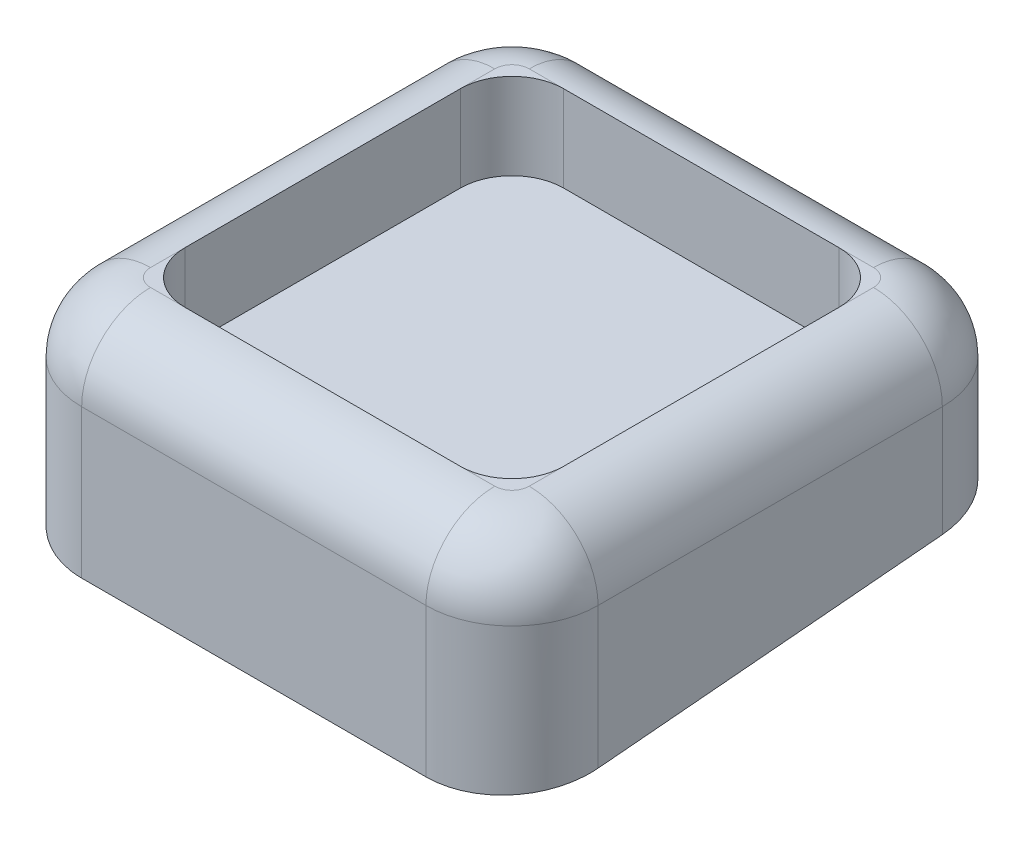
from build123d import *

# Parameters (mm, degrees)
SKETCH1_W           = 30
SKETCH1_H           = 10
BOSS_EXTRUDE1_DEPTH = 30
SKETCH2_W           = 22
SKETCH2_H           = 22
CUT_EXTRUDE1_DEPTH  = 5
FILLET1_R           = 5
FILLET2_R           = 3
FILLET3_R           = 4


with BuildPart() as part:
    # Sketch1 → Boss-Extrude1 (new body)
    with BuildSketch(Plane(origin=(0, 0, 0), x_dir=(0, 0, -1), z_dir=(1, 0, 0))):
        Polygon((-15, -5), (-15, -7.625), (15, -5), align=None)
        Rectangle(SKETCH1_W, SKETCH1_H)
    extrude(amount=BOSS_EXTRUDE1_DEPTH)

    # Sketch2 → Cut-Extrude1 (cut)
    with BuildSketch(Plane(origin=(0, 5, 0), x_dir=(1, 0, 0), z_dir=(0, 1, 0))):
        with Locations((15, 0)):
            Rectangle(SKETCH2_W, SKETCH2_H)
    extrude(amount=-CUT_EXTRUDE1_DEPTH, mode=Mode.SUBTRACT)

    # Fillet1
    fillet1_edges = [part.edges().sort_by_distance(p)[0] for p in [
        (30, 0, -15),
        (30, -1.3125, 15),
        (0, 0, -15),
        (0, -1.3125, 15),
    ]]
    fillet(fillet1_edges, radius=FILLET1_R)

    # Fillet2
    fillet2_edges = [part.edges().sort_by_distance(p)[0] for p in [
        (26, 2.5, 11),
        (4, 2.5, 11),
        (4, 2.5, -11),
        (26, 2.5, -11),
    ]]
    fillet(fillet2_edges, radius=FILLET2_R)

    # Fillet3
    fillet3_edges = [part.edges().sort_by_distance(p)[0] for p in [
        (15, 5, 15),
        (0, 5, 0),
        (30, 5, 0),
        (15, 5, -15),
        (28.535533906, 5, 13.535533906),
        (28.535533906, 5, -13.535533906),
        (1.464466094, 5, -13.535533906),
        (1.464466094, 5, 13.535533906),
    ]]
    fillet(fillet3_edges, radius=FILLET3_R - 0.0001)  # a hair under: the kernel refuses the full size


solid = part.part
